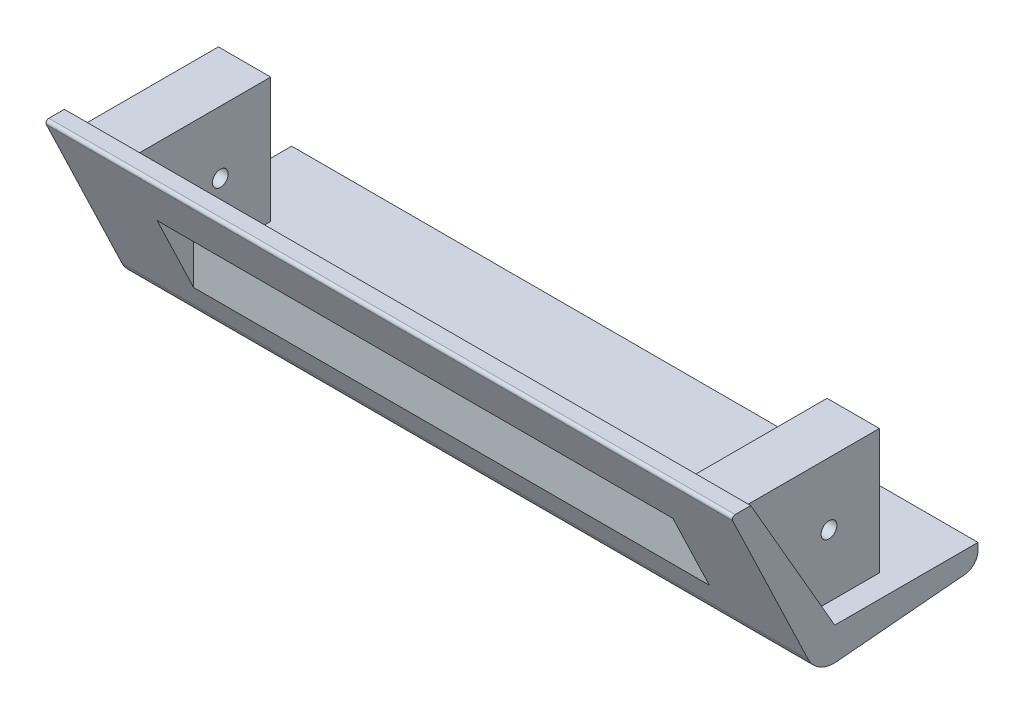
from build123d import *

# Parameters (mm, degrees)
BOSS_EXTRUDE2_DEPTH             = 119.775
BOSS_EXTRUDE1_REACH             = 141.38
SKETCH2_W                       = 18.25
SKETCH2_H                       = 43.65
BOSS_EXTRUDE1_DIRECTION_2_DEPTH = 20
CUT_EXTRUDE2_DEPTH              = 90
FILLET1_R                       = 10
FILLET2_R                       = 5
FILLET3_R                       = 1
M5_CLEARANCE_HOLE1_D            = 5.5


with BuildPart() as part:
    # Sketch1 → Boss-Extrude2 (new, symmetric)
    with BuildSketch(Plane(origin=(0, 0, 0), x_dir=(0, 0, -1), z_dir=(1, 0, 0))):
        Polygon((0, 0), (-29.329393675, 50.8), (-36.329393675, 50.8), (-6.252899132, -12), (50, -7), (50, 0), align=None)
    extrude(amount=BOSS_EXTRUDE2_DEPTH, both=True)

    # Boss-Extrude1: up to this plane
    boss_extrude1_end = Plane(origin=(119.775, 0, 0), z_dir=(0, -0.5000000000000043, 0.8660254037844362))
    # Sketch2 → Boss-Extrude1 (add, up to the surface)
    with BuildSketch(Plane.XY, mode=Mode.PRIVATE) as boss_extrude1_sk1:
        with Locations((106.225, 25.4)):
            Rectangle(SKETCH2_W, SKETCH2_H)
    boss_extrude1_tool1 = split(extrude(boss_extrude1_sk1.sketch, amount=BOSS_EXTRUDE1_REACH, mode=Mode.PRIVATE), bisect_by=boss_extrude1_end, keep=Keep.BOTH, mode=Mode.PRIVATE)
    add(boss_extrude1_tool1.solids().sort_by_distance((106.225, 25.4, 0))[0])
    # Sketch2 → Boss-Extrude1 (add, up to the surface)
    with BuildSketch(Plane.XY, mode=Mode.PRIVATE) as boss_extrude1_sk2:
        with Locations((-106.225, 25.4)):
            Rectangle(SKETCH2_W, SKETCH2_H)
    boss_extrude1_tool2 = split(extrude(boss_extrude1_sk2.sketch, amount=BOSS_EXTRUDE1_REACH, mode=Mode.PRIVATE), bisect_by=boss_extrude1_end, keep=Keep.BOTH, mode=Mode.PRIVATE)
    add(boss_extrude1_tool2.solids().sort_by_distance((-106.225, 25.4, 0))[0])

    # Sketch2 → Boss-Extrude1 direction 2 (add)
    with BuildSketch(Plane.XY):
        with Locations((106.225, 25.4)):
            Rectangle(SKETCH2_W, SKETCH2_H)
        with Locations((-106.225, 25.4)):
            Rectangle(SKETCH2_W, SKETCH2_H)
    extrude(amount=-BOSS_EXTRUDE1_DIRECTION_2_DEPTH)

    # Sketch4 → Cut-Extrude2 (cut, symmetric)
    with BuildSketch(Plane(origin=(0, 0, 0), x_dir=(0, 0, -1), z_dir=(1, 0, 0))):
        Polygon((-26.729651832, 30.755649855), (-20, 34.641016151), (-14, 24.248711306), (-14, 4.176018579), align=None)
    extrude(amount=CUT_EXTRUDE2_DEPTH, both=True, mode=Mode.SUBTRACT)

    # Fillet1
    fillet1_edges = [part.edges().sort_by_distance(p)[0] for p in [
        (0, -12, 6.252899132),
    ]]
    fillet(fillet1_edges, radius=FILLET1_R)

    # Fillet2
    fillet2_edges = [part.edges().sort_by_distance(p)[0] for p in [
        (0, -7, -50),
    ]]
    fillet(fillet2_edges, radius=FILLET2_R)

    # Fillet3
    fillet3_edges = [part.edges().sort_by_distance(p)[0] for p in [
        (0, 50.8, 36.329393675),
    ]]
    fillet(fillet3_edges, radius=FILLET3_R)

    # M5 Clearance Hole1 (through all)
    with Locations(Plane(origin=(115.35, 0, 0), x_dir=(0, 0, -1), z_dir=(1, 0, 0))):
        with Locations((2.420606325, 25.4)):
            Hole(M5_CLEARANCE_HOLE1_D / 2)


solid = part.part
